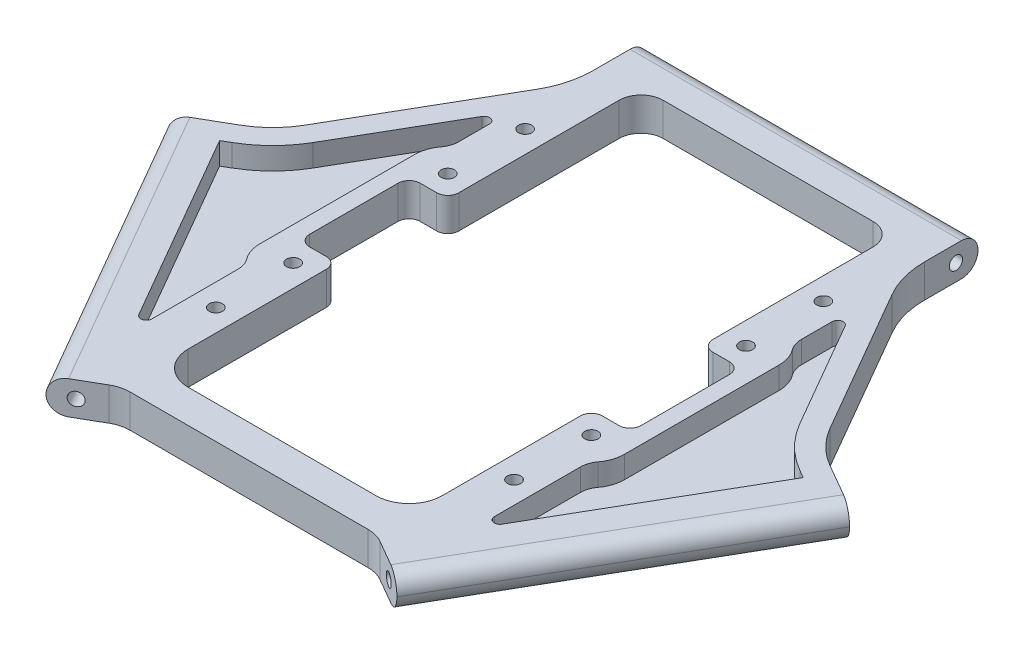
from build123d import *

# Parameters (mm, degrees)
BOSS_EXTRUDE1_DEPTH = 6
SKETCH6_R           = 1.2
CUT_EXTRUDE1_DEPTH  = 104
SKETCH4_R           = 1.2
CUT_EXTRUDE2_DEPTH  = 104
SKETCH2_R           = 1.2
CUT_EXTRUDE3_DEPTH  = 104
FILLET2_R           = 3
SKETCH11_R          = 1.2
BOSS_EXTRUDE3_DEPTH = 32
SKETCH13_R          = 1.2
BOSS_EXTRUDE4_DEPTH = 32
BOSS_EXTRUDE5_START = -32
SKETCH14_R          = 1.2
BOSS_EXTRUDE5_DEPTH = 32
SKETCH16_W          = 46
SKETCH16_H          = 88
CUT_EXTRUDE5_DEPTH  = 10
SKETCH15_R          = 1.2
CUT_EXTRUDE4_DEPTH  = 10
FILLET3_R           = 6
FILLET1_R           = 16
FILLET4_R           = 6
FILLET5_R           = 4
CUT_EXTRUDE6_DEPTH  = 10
FILLET6_R           = 2
SKETCH18_R          = 1.2
CUT_EXTRUDE7_DEPTH  = 10
CUT_EXTRUDE8_DEPTH  = 4


with BuildPart() as part:
    # Sketch1 → Boss-Extrude1 (new body)
    with BuildSketch(Plane(origin=(0, 0, 0), x_dir=(1, 0, 0), z_dir=(0, 1, 0))):
        Polygon((-30, 54), (30, 54), (30, 40.038475773), (49.674337148, 5.961524227), (61.765371804, -1.019237886), (31.765371804, -52.980762114), (23.138438763, -48), (-23.138438763, -48), (-31.765371804, -52.980762114), (-61.765371804, -1.019237886), (-49.674337148, 5.961524227), (-30, 40.038475773), align=None)
    extrude(amount=BOSS_EXTRUDE1_DEPTH)

    # Sketch6 → Cut-Extrude1 (cut)
    with BuildSketch(Plane(origin=(15, 0, -25.980762114), x_dir=(-0.8660254037844389, 0, -0.4999999999999996), z_dir=(0.4999999999999996, 0, -0.8660254037844389))):
        with Locations((-50, 3)):
            Circle(SKETCH6_R)
    extrude(amount=-CUT_EXTRUDE1_DEPTH, mode=Mode.SUBTRACT)

    # Sketch4 → Cut-Extrude2 (cut)
    with BuildSketch(Plane(origin=(-15, 0, -25.980762114), x_dir=(-0.8660254037844386, 0, 0.5), z_dir=(-0.5000000000000001, 0, -0.8660254037844387))):
        with Locations((50, 3)):
            Circle(SKETCH4_R)
    extrude(amount=-CUT_EXTRUDE2_DEPTH, mode=Mode.SUBTRACT)

    # Sketch2 → Cut-Extrude3 (cut)
    with BuildSketch(Plane.ZY.offset(30)):
        with Locations((-50, 3)):
            Circle(SKETCH2_R)
    extrude(amount=-CUT_EXTRUDE3_DEPTH, mode=Mode.SUBTRACT)

    # Fillet2
    fillet2_edges = [part.edges().sort_by_distance(p)[0] for p in [
        (46.765371804, 0, 27),
        (46.765371804, 6, 27),
        (-46.765371804, 6, 27),
        (-46.765371804, 0, 27),
        (0, 0, -54),
        (0, 6, -54),
    ]]
    fillet(fillet2_edges, radius=FILLET2_R - 0.0001)  # a hair under: the kernel refuses the full size

    # Sketch11 → Boss-Extrude3 (add)
    with BuildSketch(Plane.ZY.offset(16)):
        with Locations((-50, 3)):
            Circle(SKETCH11_R)
    extrude(amount=-BOSS_EXTRUDE3_DEPTH)

    # Sketch13 → Boss-Extrude4 (add)
    with BuildSketch(Plane(origin=(8, 0, -13.856406461), x_dir=(-0.8660254037844386, 0, -0.4999999999999999), z_dir=(0.49999999999999994, 0, -0.8660254037844387))):
        with Locations((-50, 3)):
            Circle(SKETCH13_R)
    extrude(amount=-BOSS_EXTRUDE4_DEPTH)

    # Sketch14 → Boss-Extrude5 (add)
    with BuildSketch(Plane(origin=(8, 0, 13.856406461), x_dir=(0.8660254037844386, 0, -0.4999999999999999), z_dir=(0.49999999999999994, 0, 0.8660254037844387)).offset(BOSS_EXTRUDE5_START)):
        with Locations(Location((-50, 3, 0), (0, 0, 180))):
            Circle(SKETCH14_R)
    extrude(amount=BOSS_EXTRUDE5_DEPTH)

    # Sketch16 → Cut-Extrude5 (cut)
    with BuildSketch(Plane(origin=(0, 6, 0), x_dir=(1, 0, 0), z_dir=(0, 1, 0))):
        with Locations((0, 2)):
            Rectangle(SKETCH16_W, SKETCH16_H)
    extrude(amount=-CUT_EXTRUDE5_DEPTH, mode=Mode.SUBTRACT)

    # Sketch15 → Cut-Extrude4 (cut)
    with BuildSketch(Plane(origin=(0, 6, 0), x_dir=(1, 0, 0), z_dir=(0, 1, 0))):
        with Locations(Location((27, 29, 0), (0, 0, 270))):
            Circle(SKETCH15_R)
        with Locations(Location((-27, 15, 0), (0, 0, 270))):
            Circle(SKETCH15_R)
        with Locations(Location((-27, 29, 0), (0, 0, 270))):
            Circle(SKETCH15_R)
        with Locations(Location((27, 15, 0), (0, 0, 270))):
            Circle(SKETCH15_R)
    extrude(amount=-CUT_EXTRUDE4_DEPTH, mode=Mode.SUBTRACT)

    # Fillet3
    fillet3_edges = [part.edges().sort_by_distance(p)[0] for p in [
        (-23, 3, 42),
        (23, 3, 42),
    ]]
    fillet(fillet3_edges, radius=FILLET3_R)

    # Fillet1
    fillet1_edges = [part.edges().sort_by_distance(p)[0] for p in [
        (30, 3, -40.038475773),
        (49.674337148, 3, -5.961524227),
        (-49.674337148, 3, -5.961524227),
        (-30, 3, -40.038475773),
    ]]
    fillet(fillet1_edges, radius=FILLET1_R)

    # Fillet4
    fillet4_edges = [part.edges().sort_by_distance(p)[0] for p in [
        (23.138438763, 3, 48),
        (-23.138438763, 3, 48),
    ]]
    fillet(fillet4_edges, radius=FILLET4_R)

    # Fillet5
    fillet5_edges = [part.edges().sort_by_distance(p)[0] for p in [
        (-23, 3, -46),
        (23, 3, -46),
    ]]
    fillet(fillet5_edges, radius=FILLET5_R)

    # Sketch17 → Cut-Extrude6 (cut)
    with BuildSketch(Plane(origin=(0, 6, 0), x_dir=(1, 0, 0), z_dir=(0, 1, 0))):
        with BuildLine():
            Line((23, 11), (28, 11))
            ThreePointArc((28, 11), (29.414213562, 10.414213562), (30, 9))
            Line((30, 9), (30, -7))
            ThreePointArc((30, -7), (29.414213562, -8.414213562), (28, -9))
            Line((28, -9), (23, -9))
            Line((23, -9), (23, 11))
        make_face()
        with BuildLine():
            Line((-30, 9), (-30, -7))
            ThreePointArc((-30, -7), (-29.414213562, -8.414213562), (-28, -9))
            Line((-28, -9), (-23, -9))
            Line((-23, -9), (-23, 11))
            Line((-23, 11), (-28, 11))
            ThreePointArc((-28, 11), (-29.414213562, 10.414213562), (-30, 9))
        make_face()
    extrude(amount=-CUT_EXTRUDE6_DEPTH, mode=Mode.SUBTRACT)

    # Fillet6
    fillet6_edges = [part.edges().sort_by_distance(p)[0] for p in [
        (23, 3, 9),
        (23, 3, -11),
        (-23, 3, -11),
        (-23, 3, 9),
    ]]
    fillet(fillet6_edges, radius=FILLET6_R)

    # Sketch18 → Cut-Extrude7 (cut)
    with BuildSketch(Plane(origin=(0, 6, 0), x_dir=(1, 0, 0), z_dir=(0, 1, 0))):
        with Locations(Location((27, -13, 0), (0, 0, 270))):
            Circle(SKETCH18_R)
        with Locations(Location((27, -27, 0), (0, 0, 270))):
            Circle(SKETCH18_R)
        with Locations(Location((-27, -13, 0), (0, 0, 270))):
            Circle(SKETCH18_R)
        with Locations(Location((-27, -27, 0), (0, 0, 270))):
            Circle(SKETCH18_R)
    extrude(amount=-CUT_EXTRUDE7_DEPTH, mode=Mode.SUBTRACT)

    # Sketch19 → Cut-Extrude8 (cut)
    with BuildSketch(Plane(origin=(0, 6, 0), x_dir=(1, 0, 0), z_dir=(0, 1, 0))):
        with BuildLine():
            Line((31, 26.574374158), (31, 21))
            ThreePointArc((31, 21), (31.205266808, 19.735088936), (31.8, 18.6))
            ThreePointArc((31.8, 18.6), (32.692099788, 16.897366596), (33, 15))
            Line((33, 15), (33, -13))
            ThreePointArc((33, -13), (32.692099788, -14.897366596), (31.8, -16.6))
            ThreePointArc((31.8, -16.6), (31.205266808, -17.735088936), (31, -19))
            Line((31, -19), (31, -34.574374158))
            ThreePointArc((31, -34.574374158), (31.741180955, -35.540299984), (32.866025404, -35.074374158))
            Line((32.866025404, -35.074374158), (52.837168574, -0.483339502))
            Line((52.837168574, -0.483339502), (51.387150069, 0.353829072))
            ThreePointArc((51.387150069, 0.353829072), (47.245014446, 3.532201524), (44.066641994, 7.674337148))
            Line((44.066641994, 7.674337148), (32.866025404, 27.074374158))
            ThreePointArc((32.866025404, 27.074374158), (31.741180955, 27.540299984), (31, 26.574374158))
        make_face()
        with BuildLine():
            Line((-52.837168574, -0.483339502), (-32.866025404, -35.074374158))
            ThreePointArc((-32.866025404, -35.074374158), (-31.741180955, -35.540299984), (-31, -34.574374158))
            Line((-31, -34.574374158), (-31, -19))
            ThreePointArc((-31, -19), (-31.205266808, -17.735088936), (-31.8, -16.6))
            ThreePointArc((-31.8, -16.6), (-32.692099788, -14.897366596), (-33, -13))
            Line((-33, -13), (-33, 15))
            ThreePointArc((-33, 15), (-32.692099788, 16.897366596), (-31.8, 18.6))
            ThreePointArc((-31.8, 18.6), (-31.205266808, 19.735088936), (-31, 21))
            Line((-31, 21), (-31, 26.574374158))
            ThreePointArc((-31, 26.574374158), (-31.741180955, 27.540299984), (-32.866025404, 27.074374158))
            Line((-32.866025404, 27.074374158), (-44.066641994, 7.674337148))
            ThreePointArc((-44.066641994, 7.674337148), (-47.245014446, 3.532201524), (-51.387150069, 0.353829072))
            Line((-51.387150069, 0.353829072), (-52.837168574, -0.483339502))
        make_face()
    extrude(amount=-CUT_EXTRUDE8_DEPTH, mode=Mode.SUBTRACT)


solid = part.part
